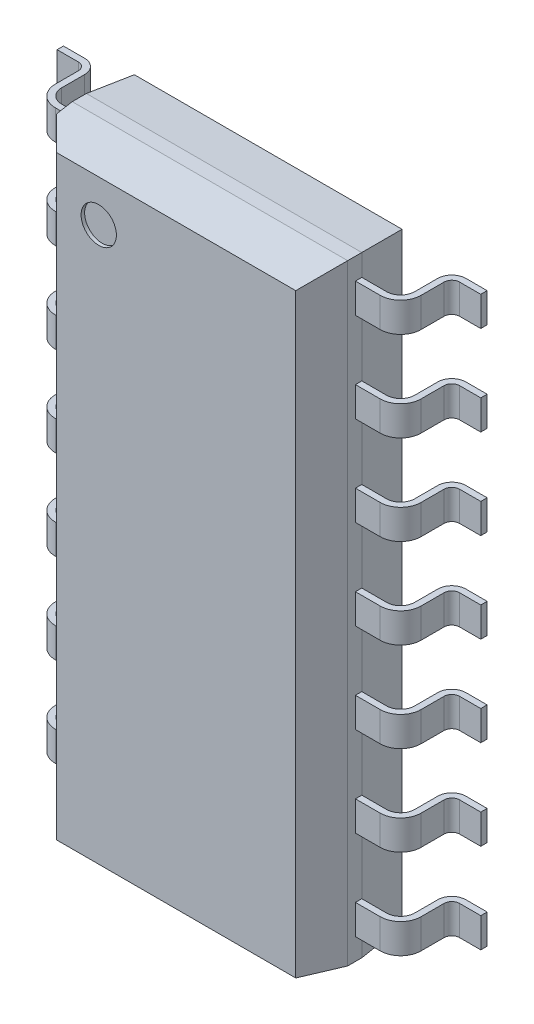
from build123d import *
from OCP.BRepFilletAPI import BRepFilletAPI_MakeChamfer

# Parameters (mm, degrees)
ESQUISSE2_W              = 3.9
ESQUISSE2_H              = 8.65
CORP_DEPTH               = 1.45
PIN_1_DEPTH              = 0.21
R_P_TITION_PIN_1_7_COUNT = 7
R_P_TITION_PIN_1_7_PITCH = 1.27
SYM_TRIE1_COPY_1_DEPTH   = 0.21
SYM_TRIE1_COPY_2_DEPTH   = 0.21
SYM_TRIE1_COPY_3_DEPTH   = 0.21
SYM_TRIE1_COPY_4_DEPTH   = 0.21
SYM_TRIE1_COPY_5_DEPTH   = 0.21
SYM_TRIE1_COPY_6_DEPTH   = 0.21
CHANFREIN4_SIZE          = 0.625
CHANFREIN4_SIZE2         = 0.110204363
CHANFREIN5_SIZE          = 0.625
CHANFREIN5_SIZE_2        = 0.054680415
ESQUISSE8_R              = 0.25
ENL_V_MAT_EXTRU_1_DEPTH  = 0.05
CHANFREIN7_SIZE          = 0.4


with BuildPart() as part:
    # Esquisse2 → corp (new body)
    with BuildSketch(Plane.XY.offset(0.1)):
        Rectangle(ESQUISSE2_W, ESQUISSE2_H)
    extrude(amount=CORP_DEPTH)

    # Esquisse6 → pin 1 (add, symmetric)
    with BuildSketch(Plane(origin=(0, 3.81, 0), x_dir=(-1, 0, 0), z_dir=(0, 1, 0))):
        with BuildLine():
            Line((1.95, 0.725), (2.3, 0.725))
            ThreePointArc((2.3, 0.725), (2.441421356, 0.666421356), (2.5, 0.525))
            Line((2.5, 0.525), (2.5, 0.2))
            ThreePointArc((2.5, 0.2), (2.558578644, 0.058578644), (2.7, 0))
            Line((2.7, 0), (3, 0))
            Line((3, 0), (3, 0.09))
            Line((3, 0.09), (2.7, 0.09))
            ThreePointArc((2.7, 0.09), (2.622218254, 0.122218254), (2.59, 0.2))
            Line((2.59, 0.2), (2.59, 0.525))
            ThreePointArc((2.59, 0.525), (2.505060967, 0.730060967), (2.3, 0.815))
            Line((2.3, 0.815), (1.95, 0.815))
            Line((1.95, 0.815), (1.95, 0.725))
        make_face()
    pin_1 = extrude(amount=PIN_1_DEPTH, both=True)

    # Répétition pin 1-7: pin 1 ×7
    with Locations(*[(0, -i * R_P_TITION_PIN_1_7_PITCH, 0) for i in range(1, R_P_TITION_PIN_1_7_COUNT)]):
        add(pin_1)

    # Symétrie1: pin 1 across plane
    add(pin_1.mirror(Plane(origin=(0, 0, 0), x_dir=(0, 0, 1), z_dir=(1, 0, 0))))

    # Symétrie1 copy 1 sketch → Symétrie1 copy 1 (add, symmetric)
    with BuildSketch(Plane(origin=(0, 2.54, 0), x_dir=(1, 0, 0), z_dir=(0, 1, 0))):
        with BuildLine():
            Line((1.95, -0.725), (2.3, -0.725))
            ThreePointArc((2.3, -0.725), (2.441421356, -0.666421356), (2.5, -0.525))
            Line((2.5, -0.525), (2.5, -0.2))
            ThreePointArc((2.5, -0.2), (2.558578644, -0.058578644), (2.7, 0))
            Line((2.7, 0), (3, 0))
            Line((3, 0), (3, -0.09))
            Line((3, -0.09), (2.7, -0.09))
            ThreePointArc((2.7, -0.09), (2.622218254, -0.122218254), (2.59, -0.2))
            Line((2.59, -0.2), (2.59, -0.525))
            ThreePointArc((2.59, -0.525), (2.505060967, -0.730060967), (2.3, -0.815))
            Line((2.3, -0.815), (1.95, -0.815))
            Line((1.95, -0.815), (1.95, -0.725))
        make_face()
    extrude(amount=SYM_TRIE1_COPY_1_DEPTH, both=True)

    # Symétrie1 copy 2 sketch → Symétrie1 copy 2 (add, symmetric)
    with BuildSketch(Plane(origin=(0, 1.27, 0), x_dir=(1, 0, 0), z_dir=(0, 1, 0))):
        with BuildLine():
            Line((1.95, -0.725), (2.3, -0.725))
            ThreePointArc((2.3, -0.725), (2.441421356, -0.666421356), (2.5, -0.525))
            Line((2.5, -0.525), (2.5, -0.2))
            ThreePointArc((2.5, -0.2), (2.558578644, -0.058578644), (2.7, 0))
            Line((2.7, 0), (3, 0))
            Line((3, 0), (3, -0.09))
            Line((3, -0.09), (2.7, -0.09))
            ThreePointArc((2.7, -0.09), (2.622218254, -0.122218254), (2.59, -0.2))
            Line((2.59, -0.2), (2.59, -0.525))
            ThreePointArc((2.59, -0.525), (2.505060967, -0.730060967), (2.3, -0.815))
            Line((2.3, -0.815), (1.95, -0.815))
            Line((1.95, -0.815), (1.95, -0.725))
        make_face()
    extrude(amount=SYM_TRIE1_COPY_2_DEPTH, both=True)

    # Symétrie1 copy 3 sketch → Symétrie1 copy 3 (add, symmetric)
    with BuildSketch(Plane(origin=(0, 0, 0), x_dir=(1, 0, 0), z_dir=(0, 1, 0))):
        with BuildLine():
            Line((1.95, -0.725), (2.3, -0.725))
            ThreePointArc((2.3, -0.725), (2.441421356, -0.666421356), (2.5, -0.525))
            Line((2.5, -0.525), (2.5, -0.2))
            ThreePointArc((2.5, -0.2), (2.558578644, -0.058578644), (2.7, 0))
            Line((2.7, 0), (3, 0))
            Line((3, 0), (3, -0.09))
            Line((3, -0.09), (2.7, -0.09))
            ThreePointArc((2.7, -0.09), (2.622218254, -0.122218254), (2.59, -0.2))
            Line((2.59, -0.2), (2.59, -0.525))
            ThreePointArc((2.59, -0.525), (2.505060967, -0.730060967), (2.3, -0.815))
            Line((2.3, -0.815), (1.95, -0.815))
            Line((1.95, -0.815), (1.95, -0.725))
        make_face()
    extrude(amount=SYM_TRIE1_COPY_3_DEPTH, both=True)

    # Symétrie1 copy 4 sketch → Symétrie1 copy 4 (add, symmetric)
    with BuildSketch(Plane(origin=(0, -1.27, 0), x_dir=(1, 0, 0), z_dir=(0, 1, 0))):
        with BuildLine():
            Line((1.95, -0.725), (2.3, -0.725))
            ThreePointArc((2.3, -0.725), (2.441421356, -0.666421356), (2.5, -0.525))
            Line((2.5, -0.525), (2.5, -0.2))
            ThreePointArc((2.5, -0.2), (2.558578644, -0.058578644), (2.7, 0))
            Line((2.7, 0), (3, 0))
            Line((3, 0), (3, -0.09))
            Line((3, -0.09), (2.7, -0.09))
            ThreePointArc((2.7, -0.09), (2.622218254, -0.122218254), (2.59, -0.2))
            Line((2.59, -0.2), (2.59, -0.525))
            ThreePointArc((2.59, -0.525), (2.505060967, -0.730060967), (2.3, -0.815))
            Line((2.3, -0.815), (1.95, -0.815))
            Line((1.95, -0.815), (1.95, -0.725))
        make_face()
    extrude(amount=SYM_TRIE1_COPY_4_DEPTH, both=True)

    # Symétrie1 copy 5 sketch → Symétrie1 copy 5 (add, symmetric)
    with BuildSketch(Plane(origin=(0, -2.54, 0), x_dir=(1, 0, 0), z_dir=(0, 1, 0))):
        with BuildLine():
            Line((1.95, -0.725), (2.3, -0.725))
            ThreePointArc((2.3, -0.725), (2.441421356, -0.666421356), (2.5, -0.525))
            Line((2.5, -0.525), (2.5, -0.2))
            ThreePointArc((2.5, -0.2), (2.558578644, -0.058578644), (2.7, 0))
            Line((2.7, 0), (3, 0))
            Line((3, 0), (3, -0.09))
            Line((3, -0.09), (2.7, -0.09))
            ThreePointArc((2.7, -0.09), (2.622218254, -0.122218254), (2.59, -0.2))
            Line((2.59, -0.2), (2.59, -0.525))
            ThreePointArc((2.59, -0.525), (2.505060967, -0.730060967), (2.3, -0.815))
            Line((2.3, -0.815), (1.95, -0.815))
            Line((1.95, -0.815), (1.95, -0.725))
        make_face()
    extrude(amount=SYM_TRIE1_COPY_5_DEPTH, both=True)

    # Symétrie1 copy 6 sketch → Symétrie1 copy 6 (add, symmetric)
    with BuildSketch(Plane(origin=(0, -3.81, 0), x_dir=(1, 0, 0), z_dir=(0, 1, 0))):
        with BuildLine():
            Line((1.95, -0.725), (2.3, -0.725))
            ThreePointArc((2.3, -0.725), (2.441421356, -0.666421356), (2.5, -0.525))
            Line((2.5, -0.525), (2.5, -0.2))
            ThreePointArc((2.5, -0.2), (2.558578644, -0.058578644), (2.7, 0))
            Line((2.7, 0), (3, 0))
            Line((3, 0), (3, -0.09))
            Line((3, -0.09), (2.7, -0.09))
            ThreePointArc((2.7, -0.09), (2.622218254, -0.122218254), (2.59, -0.2))
            Line((2.59, -0.2), (2.59, -0.525))
            ThreePointArc((2.59, -0.525), (2.505060967, -0.730060967), (2.3, -0.815))
            Line((2.3, -0.815), (1.95, -0.815))
            Line((1.95, -0.815), (1.95, -0.725))
        make_face()
    extrude(amount=SYM_TRIE1_COPY_6_DEPTH, both=True)

    # Chanfrein4: one chamfer whose edges measure the first distance from different faces: ONE call of the kernel's chamfer builder (chamfer() names one face for all edges)
    chanfrein4_edges_1 = [part.edges().sort_by_distance(p)[0] for p in [
        (1.95, 0, 1.55),
    ]]
    chanfrein4_side_1 = [part.faces().sort_by_distance(p)[0] for p in [
        (1.95, 0, 0.8261853),
    ]]
    chanfrein4_edges_2 = [part.edges().sort_by_distance(p)[0] for p in [
        (0, 4.325, 1.55),
    ]]
    chanfrein4_side_2 = [part.faces().sort_by_distance(p)[0] for p in [
        (0, 4.325, 0.825),
    ]]
    chanfrein4_edges_3 = [part.edges().sort_by_distance(p)[0] for p in [
        (0, -4.325, 1.55),
    ]]
    chanfrein4_side_3 = [part.faces().sort_by_distance(p)[0] for p in [
        (0, -4.325, 0.825),
    ]]
    chanfrein4 = BRepFilletAPI_MakeChamfer(part.part.solid().wrapped)
    for e in chanfrein4_edges_1:
        chanfrein4.Add(CHANFREIN4_SIZE, CHANFREIN4_SIZE2, e.wrapped, chanfrein4_side_1[0].wrapped)  # the first distance lies on this face
    for e in chanfrein4_edges_2:
        chanfrein4.Add(CHANFREIN4_SIZE, CHANFREIN4_SIZE2, e.wrapped, chanfrein4_side_2[0].wrapped)  # the first distance lies on this face
    for e in chanfrein4_edges_3:
        chanfrein4.Add(CHANFREIN4_SIZE, CHANFREIN4_SIZE2, e.wrapped, chanfrein4_side_3[0].wrapped)  # the first distance lies on this face
    add(Compound.cast(chanfrein4.Shape()), mode=Mode.REPLACE)

    # Chanfrein5
    chanfrein5_edges_1 = [part.edges().sort_by_distance(p)[0] for p in [
        (0, 4.325, 0.1),
    ]]
    chanfrein5_side_1 = [part.faces().sort_by_distance(p)[0] for p in [
        (0, 4.325, 0.101093608),
    ]]
    chanfrein5_edges_2 = [part.edges().sort_by_distance(p)[0] for p in [
        (1.95, 0, 0.1),
    ]]
    chanfrein5_side_2 = [part.faces().sort_by_distance(p)[0] for p in [
        (1.948906392, 0, 0.1),
    ]]
    chanfrein5_edges_3 = [part.edges().sort_by_distance(p)[0] for p in [
        (0, -4.325, 0.1),
    ]]
    chanfrein5_side_3 = [part.faces().sort_by_distance(p)[0] for p in [
        (0, -4.323906392, 0.1),
    ]]
    chanfrein5_edges_4 = [part.edges().sort_by_distance(p)[0] for p in [
        (-1.95, 0, 0.1),
    ]]
    chanfrein5_side_4 = [part.faces().sort_by_distance(p)[0] for p in [
        (-1.95, 0, 0.101093608),
    ]]
    chanfrein5 = BRepFilletAPI_MakeChamfer(part.part.solid().wrapped)
    for e in chanfrein5_edges_1:
        chanfrein5.Add(CHANFREIN5_SIZE - 0.0001, CHANFREIN5_SIZE_2 - 0.0001, e.wrapped, chanfrein5_side_1[0].wrapped)
    for e in chanfrein5_edges_2:
        chanfrein5.Add(CHANFREIN5_SIZE_2 - 0.0001, CHANFREIN5_SIZE - 0.0001, e.wrapped, chanfrein5_side_2[0].wrapped)
    for e in chanfrein5_edges_3:
        chanfrein5.Add(CHANFREIN5_SIZE_2 - 0.0001, CHANFREIN5_SIZE - 0.0001, e.wrapped, chanfrein5_side_3[0].wrapped)
    for e in chanfrein5_edges_4:
        chanfrein5.Add(CHANFREIN5_SIZE - 0.0001, CHANFREIN5_SIZE_2 - 0.0001, e.wrapped, chanfrein5_side_4[0].wrapped)
    add(Compound.cast(chanfrein5.Shape()), mode=Mode.REPLACE)  # a hair under: the kernel refuses the full size

    # Esquisse8 → Enlèv. mat.-Extru.1 (cut)
    with BuildSketch(Plane.XY.offset(1.55)):
        with Locations((-0.95, 3.625)):
            Circle(ESQUISSE8_R)
    extrude(amount=-ENL_V_MAT_EXTRU_1_DEPTH, mode=Mode.SUBTRACT)

    # Chanfrein7
    chanfrein7_edges = [part.edges().sort_by_distance(p)[0] for p in [
        (-1.95, 0, 1.55),
    ]]
    chamfer(chanfrein7_edges, length=CHANFREIN7_SIZE)


solid = part.part
